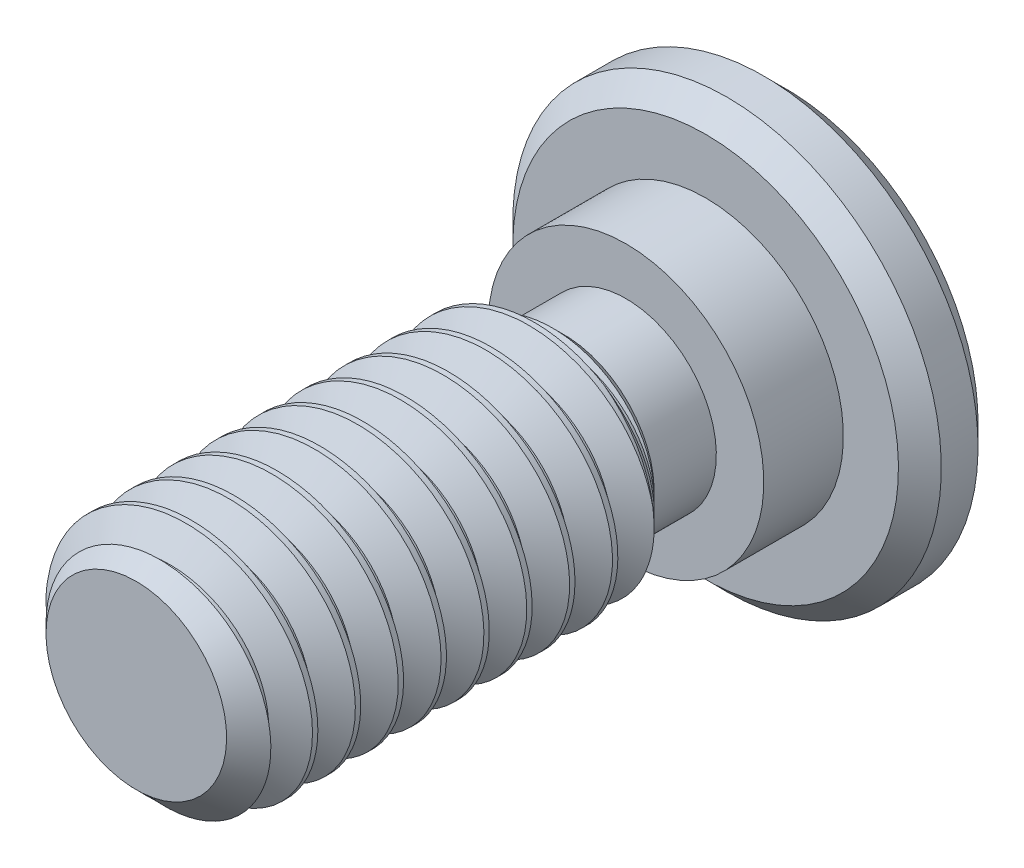
from build123d import *

# Parameters (mm, degrees)
CHAMFER2_SIZE      = 0.525
CUT_EXTRUDE1_DEPTH = 1.875
CHAMFER1_SIZE      = 0.35
CUT_SWEEP1_PITCH   = 0.7


with BuildPart() as part:
    # Sketch13 → Revolve1 (revolve)
    with BuildSketch(Plane(origin=(0, 0, 0), x_dir=(0, 0, -1), z_dir=(1, 0, 0)), mode=Mode.PRIVATE) as revolve1_sk:
        Polygon((1.3, 3.5), (0, 3.5), (0, 2.25), (-1.3, 2.25), (-1.3, 1.475), (-2.316, 1.475), (-2.841, 2), (-9.3, 2), (-9.3, 0), (1.3, 0), align=None)
    revolve(revolve1_sk.sketch.rotate(Axis((0, 0, 9.3), (0, 0, -1)), 180), axis=Axis((0, 0, 9.3), (0, 0, -1)))

    # Chamfer2
    chamfer2_edges = [part.edges().sort_by_distance(p)[0] for p in [
        (0, 2, 9.3),
    ]]
    chamfer(chamfer2_edges, length=CHAMFER2_SIZE)

    # Sketch7 → Cut-Extrude1 (cut)
    with BuildSketch(Plane(origin=(0, 0, -1.3), x_dir=(-1, 0, 0), z_dir=(0, 0, -1))):
        Polygon((0, 1.443375673), (-1.25, 0.721687836), (-1.25, -0.721687836), (0, -1.443375673), (1.25, -0.721687836), (1.25, 0.721687836), align=None)
    extrude(amount=-CUT_EXTRUDE1_DEPTH, mode=Mode.SUBTRACT)

    # Chamfer1
    chamfer1_edges = [part.edges().sort_by_distance(p)[0] for p in [
        (0, 3.5, 0),
        (0, 3.5, -1.3),
    ]]
    chamfer(chamfer1_edges, length=CHAMFER1_SIZE)

    # Cut-Extrude2 cone 1 section (through the dimple's axis) → Cut-Extrude2 (revolve, cut)
    with BuildSketch(Plane(origin=(0, 0, -1.3), x_dir=(0, 1, 0), z_dir=(1, 0, 0))):
        Polygon((0, 0), (1.443375673, 0), (0, 1.443375673), align=None)
    revolve(axis=Axis((0, 0, -1.3), (0, 0, 1)), mode=Mode.SUBTRACT)

    # Cut-Sweep1: the profile of Sketch3 screwed along a right-hand helix of 11.285714 turns, 6 arcs to a turn; built about Z, then put on its axis
    cut_sweep1_z = Axis((0, 0, 0), (0, 0, 1))
    cut_sweep1_corners = [(2.037888611, 0, -0.634375), (2.037888611, 0, 0.021875), (1.545336663, 0, -0.2625), (1.545336663, 0, -0.35)]
    with BuildLine(mode=Mode.PRIVATE) as cut_sweep1_profile:
        Line(cut_sweep1_corners[0], cut_sweep1_corners[1])
        Line(cut_sweep1_corners[1], cut_sweep1_corners[2])
        Line(cut_sweep1_corners[2], cut_sweep1_corners[3])
        Line(cut_sweep1_corners[3], cut_sweep1_corners[0])
    cut_sweep1_cap = Face(cut_sweep1_profile.wire())
    cut_sweep1_turn_angles = [0, 30, 60, 90, 120, 150, 180, 210, 240, 270, 300, 330, 360]
    cut_sweep1_turn_weights = [1, 0.8660254037844387, 1, 0.8660254037844387, 1, 0.8660254037844387, 1, 0.8660254037844387, 1, 0.8660254037844387, 1, 0.8660254037844387, 1]
    cut_sweep1_turn_rails = [Edge.make_bspline([Vector(p[0], p[1], 0).rotate(cut_sweep1_z, cut_sweep1_turn_angles[k]) / cut_sweep1_turn_weights[k] + Vector(0, 0, p[2] + CUT_SWEEP1_PITCH * cut_sweep1_turn_angles[k] / 360) for k in range(13)], [0, 0, 0, 1, 1, 2, 2, 3, 3, 4, 4, 5, 5, 6, 6, 6], 2, cut_sweep1_turn_weights) for p in cut_sweep1_corners]
    cut_sweep1_turn_sides = [Face.make_surface_from_curves(cut_sweep1_turn_rails[p[0]], cut_sweep1_turn_rails[p[1]]) for p in [(0, 1), (1, 2), (2, 3), (3, 0)]]
    cut_sweep1_last_angles = [3960, 3990, 4020, 4041.428571429, 4062.857142857]
    cut_sweep1_last_weights = [1, 0.8660254037844387, 1, 0.9308737486442832, 1]
    cut_sweep1_last_rails = [Edge.make_bspline([Vector(p[0], p[1], 0).rotate(cut_sweep1_z, cut_sweep1_last_angles[k]) / cut_sweep1_last_weights[k] + Vector(0, 0, p[2] + CUT_SWEEP1_PITCH * cut_sweep1_last_angles[k] / 360) for k in range(5)], [0, 0, 0, 1, 1, 2, 2, 2], 2, cut_sweep1_last_weights) for p in cut_sweep1_corners]
    cut_sweep1_last_sides = [Face.make_surface_from_curves(cut_sweep1_last_rails[p[0]], cut_sweep1_last_rails[p[1]]) for p in [(0, 1), (1, 2), (2, 3), (3, 0)]]
    cut_sweep1 = Plane(origin=(0, 0, 9.3), x_dir=(0, 1, 0), z_dir=(0, 0, -1)) * Solid(Shell([*[p.moved(Location((0, 0, CUT_SWEEP1_PITCH * i))) for i in range(11) for p in cut_sweep1_turn_sides], *cut_sweep1_last_sides, cut_sweep1_cap, cut_sweep1_cap.rotate(cut_sweep1_z, 4062.857142857).moved(Location((0, 0, CUT_SWEEP1_PITCH * 4062.857142857 / 360)))]))
    add(cut_sweep1, mode=Mode.SUBTRACT)


solid = part.part
